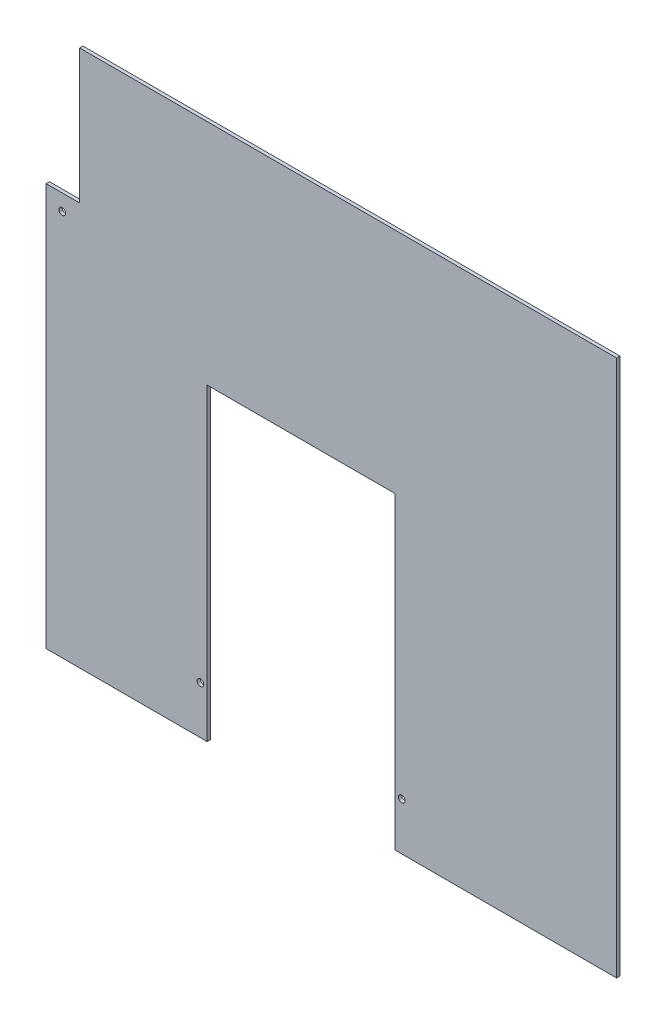
from build123d import *

# Parameters (mm, degrees)
SKETCH1_W           = 539.75
SKETCH1_H           = 508
BOSS_EXTRUDE1_DEPTH = 3.175
SKETCH2_R           = 3.175
SKETCH2_W           = 177.8
SKETCH2_H           = 292.1
CUT_EXTRUDE1_DEPTH  = 44.45
SKETCH3_W           = 31.75
SKETCH3_H           = 127
CUT_EXTRUDE2_DEPTH  = 742.218013222


with BuildPart() as part:
    # Sketch1 → Boss-Extrude1 (new body)
    with BuildSketch(Plane.XY):
        with Locations((269.875, 254)):
            Rectangle(SKETCH1_W, SKETCH1_H)
    extrude(amount=BOSS_EXTRUDE1_DEPTH)

    # Sketch2 → Cut-Extrude1 (cut)
    with BuildSketch(Plane(origin=(0, 0, 0), x_dir=(-1, 0, 0), z_dir=(0, 0, -1))):
        with Locations((-336.55, 45.085)):
            Circle(SKETCH2_R)
        with Locations((-146.05, 45.085)):
            Circle(SKETCH2_R)
        with Locations((-15.24, 365.76)):
            Circle(SKETCH2_R)
        with Locations((-241.3, 146.05)):
            Rectangle(SKETCH2_W, SKETCH2_H)
    extrude(amount=-CUT_EXTRUDE1_DEPTH, mode=Mode.SUBTRACT)

    # Sketch3 → Cut-Extrude2 (cut, through all)
    with BuildSketch(Plane(origin=(0, 0, 0), x_dir=(-1, 0, 0), z_dir=(0, 0, -1))):
        with Locations((-15.875, 444.5)):
            Rectangle(SKETCH3_W, SKETCH3_H)
    extrude(amount=-CUT_EXTRUDE2_DEPTH, mode=Mode.SUBTRACT)


solid = part.part
